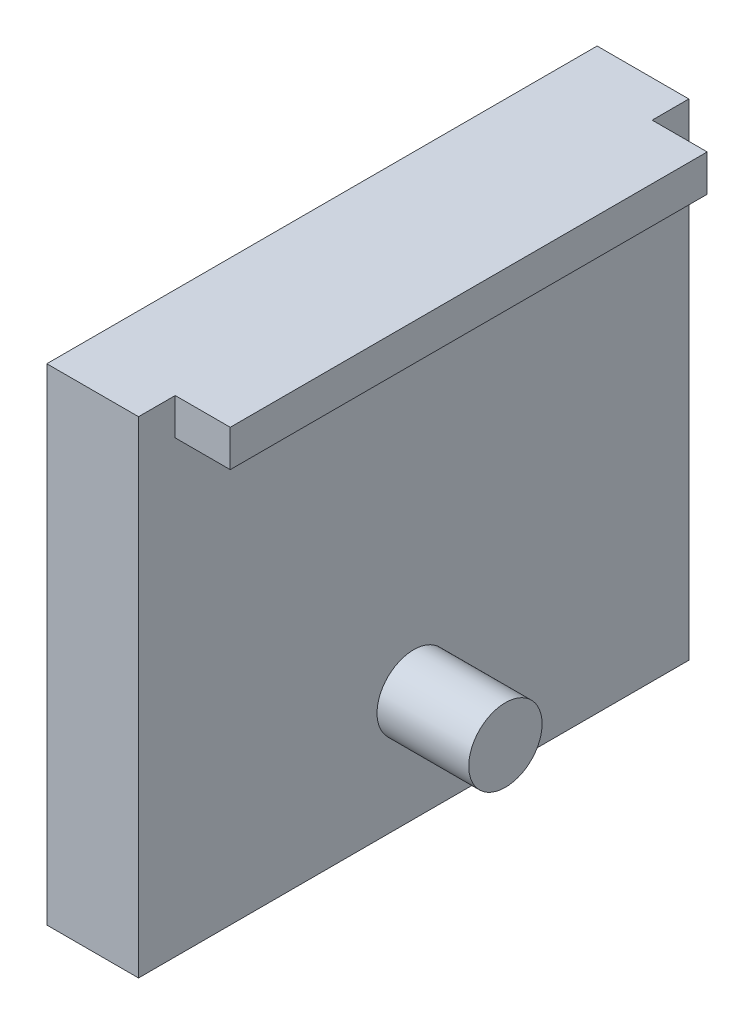
from build123d import *

# Parameters (mm, degrees)
SKETCH1_W           = 30
SKETCH1_H           = 26.5
BOSS_EXTRUDE1_DEPTH = 2.5
SKETCH2_W           = 22
SKETCH2_H           = 2
BOSS_EXTRUDE2_DEPTH = 0.5
SKETCH3_W           = 26
SKETCH3_H           = 2
BOSS_EXTRUDE3_DEPTH = 1.5
SKETCH4_R           = 2
BOSS_EXTRUDE4_DEPTH = 2.5


with BuildPart() as part:
    # Sketch1 → Boss-Extrude1 (new, symmetric)
    with BuildSketch(Plane(origin=(-181, 0, 0), x_dir=(0, 0, -1), z_dir=(1, 0, 0))):
        with Locations((-149, 50.25)):
            Rectangle(SKETCH1_W, SKETCH1_H)
    extrude(amount=BOSS_EXTRUDE1_DEPTH, both=True)

    # Sketch2 → Boss-Extrude2 (add, symmetric)
    with BuildSketch(Plane(origin=(-183.5, 0, 0), x_dir=(0, 0, -1), z_dir=(1, 0, 0))):
        with Locations((-149, 41)):
            Rectangle(SKETCH2_W, SKETCH2_H)
        with Locations((-149, 45)):
            Rectangle(SKETCH2_W, SKETCH2_H)
    extrude(amount=BOSS_EXTRUDE2_DEPTH, both=True)

    # Sketch3 → Boss-Extrude3 (add, symmetric)
    with BuildSketch(Plane(origin=(-177, 0, 0), x_dir=(0, 0, -1), z_dir=(1, 0, 0))):
        with Locations((-149, 62.5)):
            Rectangle(SKETCH3_W, SKETCH3_H)
    extrude(amount=BOSS_EXTRUDE3_DEPTH, both=True)

    # Sketch4 → Boss-Extrude4 (add, symmetric)
    with BuildSketch(Plane(origin=(-176, 0, 0), x_dir=(0, 0, -1), z_dir=(1, 0, 0))):
        with Locations((-149, 43)):
            Circle(SKETCH4_R)
    extrude(amount=BOSS_EXTRUDE4_DEPTH, both=True)


solid = part.part
